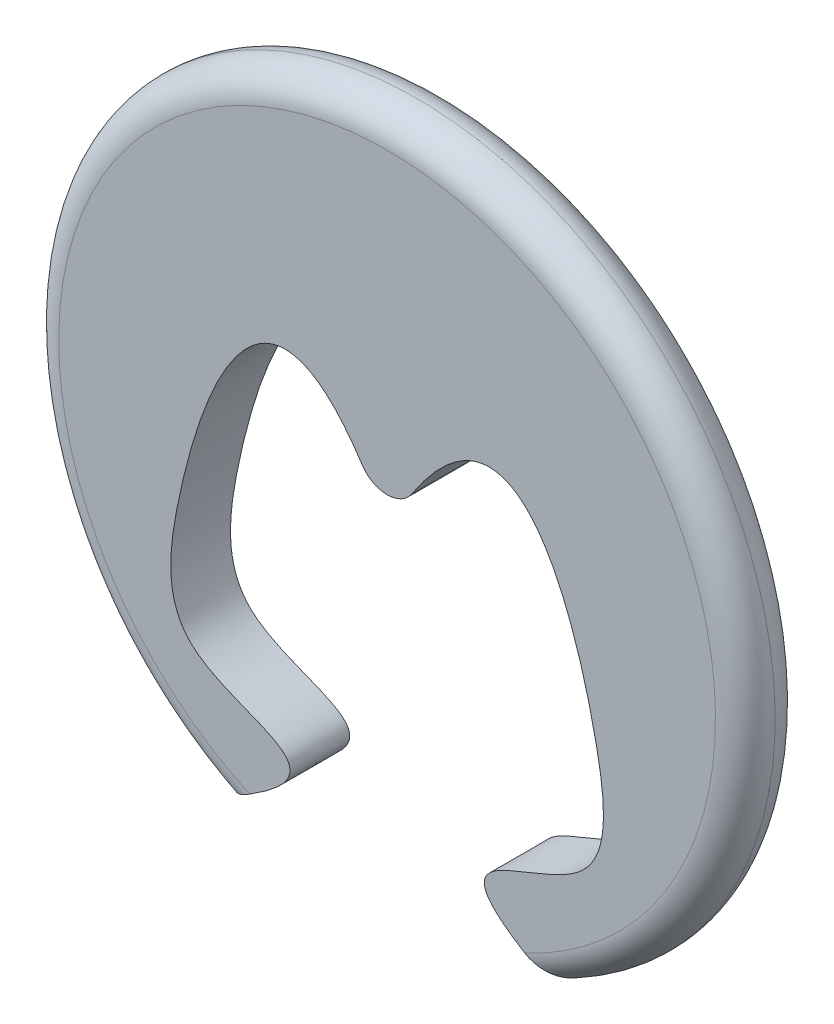
from build123d import *

# Parameters (mm, degrees)
SALIENTE_EXTRUIR1_DEPTH = 2
REDONDEO1_R             = 1
REDONDEO2_R             = 1


with BuildPart() as part:
    # Croquis1 → Saliente-Extruir1 (new body)
    with BuildSketch(Plane.XY):
        with BuildLine():
            ThreePointArc((5.655764002, -10.583587934), (0, 12), (-5.655764002, -10.583587934))
            add(Edge.make_bspline(
                [(-5.655764002, -10.583587934), (-0.474469774, -7.833786927), (-7.753192635, -8.222412063), (-6.809703352, 0.322044678), (-3.659798819, 7.117432674), (0, 0)],
                knots=[0, 0, 0, 0, 0.294178074, 0.466965283, 1, 1, 1, 1], degree=3))
            add(Edge.make_bspline(
                [(5.655764002, -10.583587934), (0.474469774, -7.833786927), (7.753192635, -8.222412063), (6.809703352, 0.322044678), (3.659798819, 7.117432674), (0, 0)],
                knots=[0, 0, 0, 0, 0.294178074, 0.466965283, 1, 1, 1, 1], degree=3))
        make_face()
    extrude(amount=SALIENTE_EXTRUIR1_DEPTH)

    # Redondeo1
    redondeo1_edges = [part.edges().sort_by_distance(p)[0] for p in [
        (0, 0, 1),
    ]]
    fillet(redondeo1_edges, radius=REDONDEO1_R)

    # Redondeo2
    redondeo2_edges = [part.edges().sort_by_distance(p)[0] for p in [
        (0, 12, 2),
        (0, 12, 0),
    ]]
    fillet(redondeo2_edges, radius=REDONDEO2_R - 0.0001)  # a hair under: the kernel refuses the full size


solid = part.part
